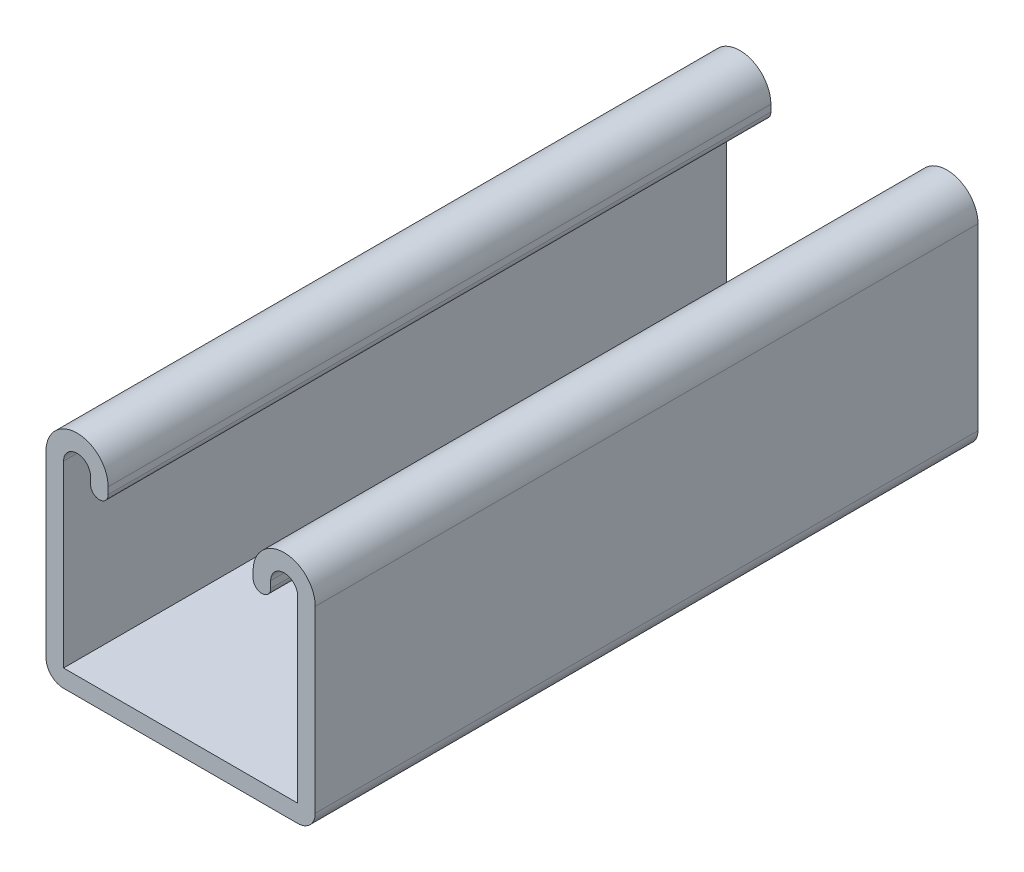
from build123d import *

# Parameters (mm, degrees)
BASE_EXTRUDE_DEPTH = 101.6
HOLE1_START        = -15.0114
HOLE1_OUTLINE_R    = 7.14375
HOLE1_DEPTH        = 2.6924
LPATTERN2_COUNT    = 2
LPATTERN2_PITCH    = 47.625


# Read off the part's stored shape, not the designer's step: Hole1
with BuildPart() as part:
    # Sketch1 → Base-Extrude (new body)
    with BuildSketch(Plane.XY):
        with BuildLine():
            Line((-20.6375, 15.1511), (-20.6375, -12.319))
            ThreePointArc((-20.6375, -12.319), (-19.848914298, -14.222814298), (-17.9451, -15.0114))
            Line((-17.9451, -15.0114), (17.9451, -15.0114))
            ThreePointArc((17.9451, -15.0114), (19.848914298, -14.222814298), (20.6375, -12.319))
            Line((20.6375, -12.319), (20.6375, 15.1511))
            ThreePointArc((20.6375, 15.1511), (15.875, 19.9136), (11.1125, 15.1511))
            Line((11.1125, 15.1511), (11.1125, 14.11605))
            ThreePointArc((11.1125, 14.11605), (12.4587, 12.76985), (13.8049, 14.11605))
            Line((13.8049, 14.11605), (13.8049, 15.1511))
            ThreePointArc((13.8049, 15.1511), (15.875, 17.2212), (17.9451, 15.1511))
            Line((17.9451, 15.1511), (17.9451, -12.319))
            Line((17.9451, -12.319), (-17.9451, -12.319))
            Line((-17.9451, -12.319), (-17.9451, 15.1511))
            ThreePointArc((-17.9451, 15.1511), (-15.875, 17.2212), (-13.8049, 15.1511))
            Line((-13.8049, 15.1511), (-13.8049, 14.11605))
            ThreePointArc((-13.8049, 14.11605), (-12.4587, 12.76985), (-11.1125, 14.11605))
            Line((-11.1125, 14.11605), (-11.1125, 15.1511))
            ThreePointArc((-11.1125, 15.1511), (-15.875, 19.9136), (-20.6375, 15.1511))
        make_face()
    extrude(amount=BASE_EXTRUDE_DEPTH)

    # Hole1 outline → Hole1 (cut)
    with BuildSketch(Plane(origin=(0, 0, 0), x_dir=(1, 0, 0), z_dir=(0, 1, 0)).offset(HOLE1_START)):
        with Locations((0, -23.8125)):
            Circle(HOLE1_OUTLINE_R)
    hole1 = extrude(amount=HOLE1_DEPTH, mode=Mode.SUBTRACT)

    # LPattern2: Hole1 ×2
    with Locations(*[(0, 0, i * LPATTERN2_PITCH) for i in range(1, LPATTERN2_COUNT)]):
        add(hole1, mode=Mode.SUBTRACT)


solid = part.part
